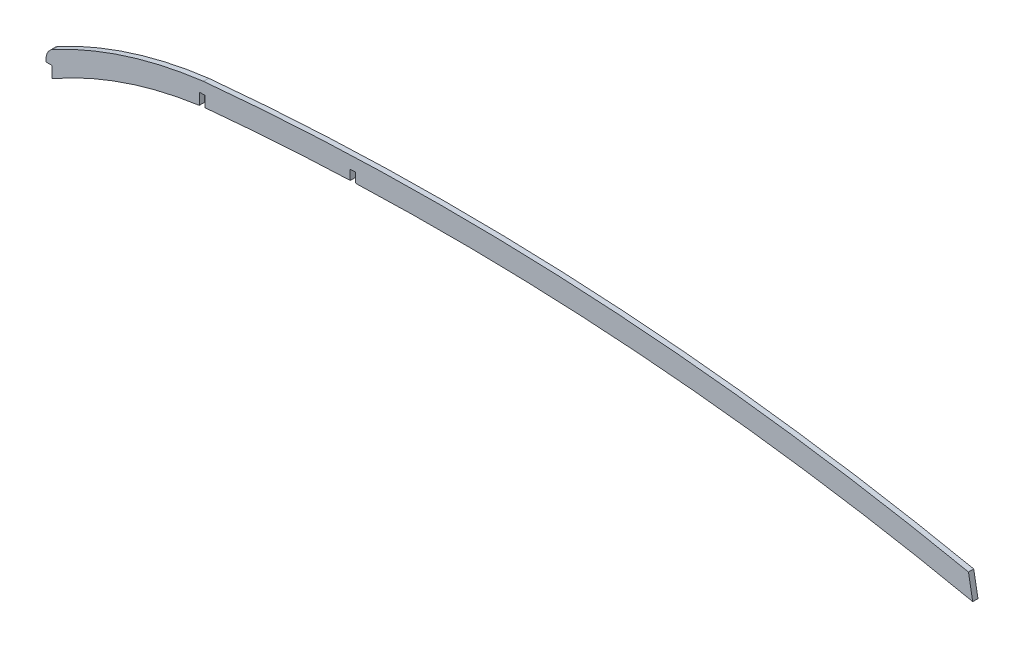
from build123d import *

# Parameters (mm, degrees)
BOSS_EXTRUDE1_DEPTH = 1.5875


with BuildPart() as part:
    # Sketch1 → Boss-Extrude1 (new, symmetric)
    with BuildSketch(Plane.XY):
        with BuildLine():
            Line((0, 101.6), (0, 100.055269774))
            Line((0, 100.055269774), (3.749926944, 100.055269774))
            Line((3.749926944, 100.055269774), (3.749926944, 93.197269774))
            ThreePointArc((3.749926944, 93.197269774), (46.592607477, 112.602219611), (92.329, 123.567152459))
            Line((92.329, 123.567152459), (92.329, 130.517973266))
            Line((92.329, 130.517973266), (95.631, 130.517973266))
            Line((95.631, 130.517973266), (95.631, 124.010897007))
            ThreePointArc((95.631, 124.010897007), (95.971054745, 124.054032816), (96.311168805, 124.096698424))
            ThreePointArc((96.311168805, 124.096698424), (139.761460521, 127.601280315), (183.294042864, 129.86495412))
            Line((183.294042864, 129.86495412), (183.050163268, 135.689672274))
            Line((183.050163268, 135.689672274), (186.349272737, 135.827805221))
            Line((186.349272737, 135.827805221), (186.59387592, 129.985805221))
            ThreePointArc((186.59387592, 129.985805221), (373.402899557, 125.190779028), (558.229469453, 97.627349478))
            Line((558.229469453, 97.627349478), (555.638244479, 111.822940798))
            ThreePointArc((555.638244479, 111.822940798), (326.208122032, 141.94293007), (94.854415026, 137.375973266))
            ThreePointArc((94.854415026, 137.375973266), (48.266347056, 127.216011607), (4.300521626, 108.758517405))
            ThreePointArc((4.300521626, 108.758517405), (1.157792804, 105.775489723), (0, 101.6))
        make_face()
    extrude(amount=BOSS_EXTRUDE1_DEPTH, both=True)


solid = part.part
